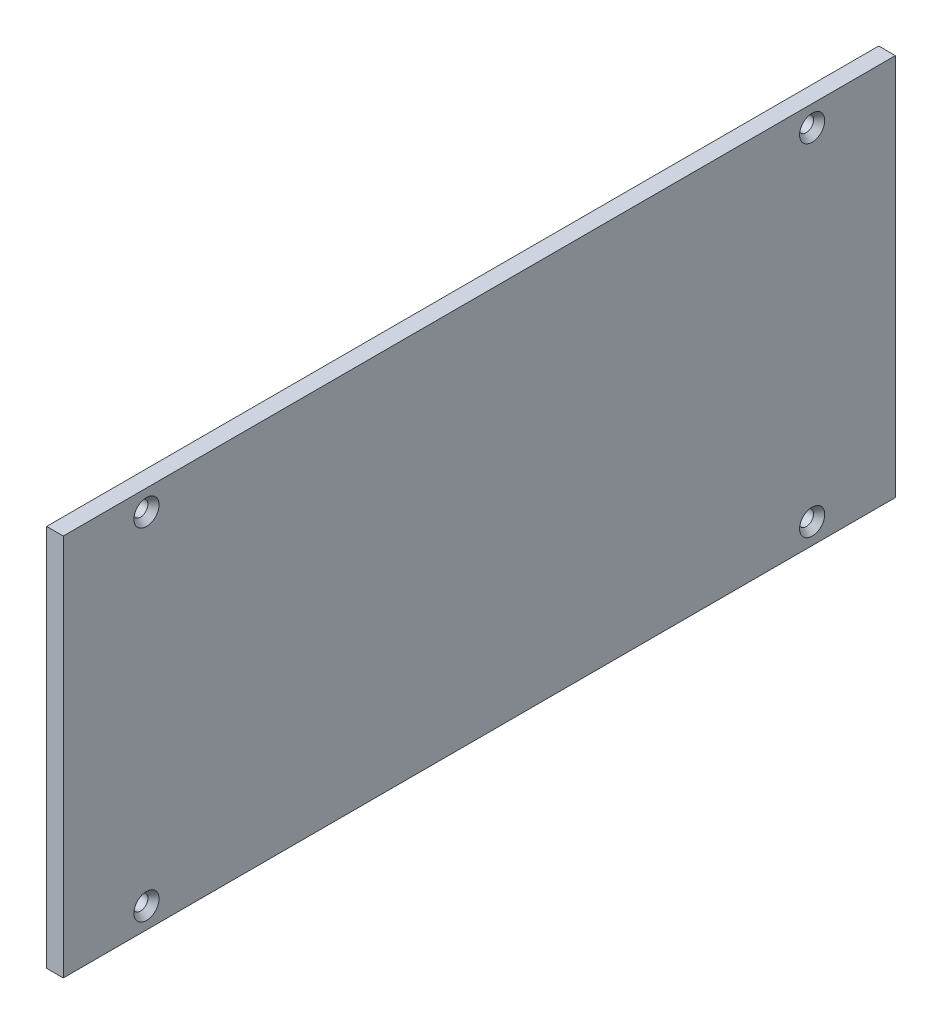
from build123d import *

# Parameters (mm, degrees)
SKETCH1_W                                      = 100
SKETCH1_H                                      = 46
BOSS_EXTRUDE1_DEPTH                            = 2
CSK_FOR_0_FLAT_HEAD_MACHINE_SCREW1_D           = 1.778
CSK_FOR_0_FLAT_HEAD_MACHINE_SCREW1_CSINK_D     = 3.0226
CSK_FOR_0_FLAT_HEAD_MACHINE_SCREW1_CSINK_ANGLE = 82


with BuildPart() as part:
    # Sketch1 → Boss-Extrude1 (new body)
    with BuildSketch(Plane(origin=(0, 0, 0), x_dir=(0, 0, -1), z_dir=(1, 0, 0))):
        with Locations((50, 23)):
            Rectangle(SKETCH1_W, SKETCH1_H)
    extrude(amount=BOSS_EXTRUDE1_DEPTH)

    # CSK for #0 Flat Head Machine Screw1 (through all)
    with Locations(Plane(origin=(2, 0, 0), x_dir=(0, 0, -1), z_dir=(1, 0, 0))):
        with Locations((10, 43.5), (10, 2.5), (90, 2.5), (90, 43.5)):
            CounterSinkHole(CSK_FOR_0_FLAT_HEAD_MACHINE_SCREW1_D / 2, CSK_FOR_0_FLAT_HEAD_MACHINE_SCREW1_CSINK_D / 2, counter_sink_angle=CSK_FOR_0_FLAT_HEAD_MACHINE_SCREW1_CSINK_ANGLE)


solid = part.part
